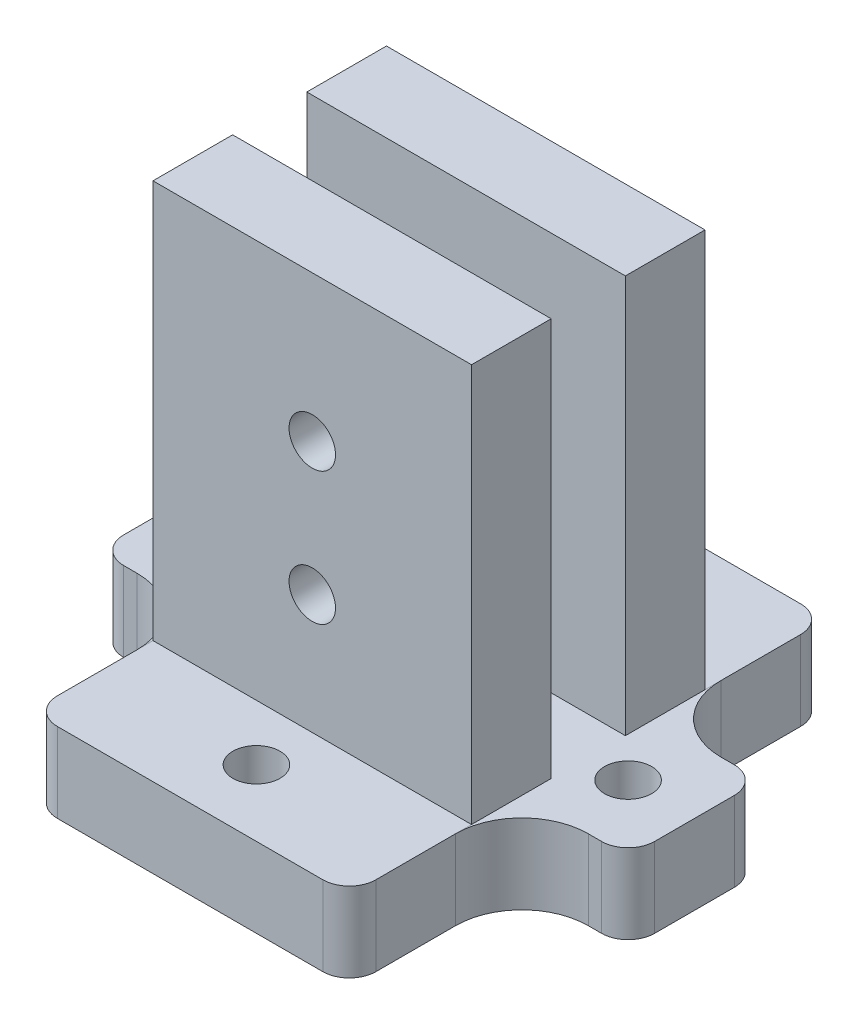
from build123d import *

# Parameters (mm, degrees)
SKETCH1_W           = 24
SKETCH1_H           = 24
BOSS_EXTRUDE1_DEPTH = 6
SKETCH2_W           = 24
SKETCH2_H           = 6
BOSS_EXTRUDE2_DEPTH = 30
SKETCH3_W           = 24
SKETCH3_H           = 6
BOSS_EXTRUDE3_DEPTH = 6
SKETCH4_W           = 24
SKETCH4_H           = 6
BOSS_EXTRUDE4_DEPTH = 6
SKETCH5_W           = 10
SKETCH5_H           = 6
BOSS_EXTRUDE5_DEPTH = 8
FILLET1_R           = 5
FILLET2_R           = 2
FILLET3_R           = 2
SKETCH6_W           = 10
SKETCH6_H           = 6
BOSS_EXTRUDE6_DEPTH = 8
FILLET4_R           = 5
FILLET5_R           = 2
SKETCH7_R           = 1.775
CUT_EXTRUDE1_DEPTH  = 42.568724431
CUT_EXTRUDE2_REACH  = 51.934
SKETCH8_R           = 1.75


with BuildPart() as part:
    # Sketch1 → Boss-Extrude1 (new body)
    with BuildSketch(Plane(origin=(0, 0, 0), x_dir=(1, 0, 0), z_dir=(0, 1, 0))):
        with Locations((1.896724894, -0.667948192)):
            Rectangle(SKETCH1_W, SKETCH1_H)
    extrude(amount=BOSS_EXTRUDE1_DEPTH)

    # Sketch2 → Boss-Extrude2 (add)
    with BuildSketch(Plane(origin=(0, 6, 0), x_dir=(1, 0, 0), z_dir=(0, 1, 0))):
        with Locations((1.896724894, -6.462948192)):
            Rectangle(SKETCH2_W, SKETCH2_H)
        with Locations((1.896724894, 5.127051808)):
            Rectangle(SKETCH2_W, SKETCH2_H)
    extrude(amount=BOSS_EXTRUDE2_DEPTH)

    # Sketch3 → Boss-Extrude3 (add)
    with BuildSketch(Plane.XY.offset(12.667948192)):
        with Locations((1.896724894, 3)):
            Rectangle(SKETCH3_W, SKETCH3_H)
    extrude(amount=BOSS_EXTRUDE3_DEPTH)

    # Sketch4 → Boss-Extrude4 (add)
    with BuildSketch(Plane(origin=(0, 0, -11.332051808), x_dir=(-1, 0, 0), z_dir=(0, 0, -1))):
        with Locations((-1.896724894, 3)):
            Rectangle(SKETCH4_W, SKETCH4_H)
    extrude(amount=BOSS_EXTRUDE4_DEPTH)

    # Sketch5 → Boss-Extrude5 (add)
    with BuildSketch(Plane(origin=(13.896724894, 0, 0), x_dir=(0, 0, -1), z_dir=(1, 0, 0))):
        with Locations((-0.667948192, 3)):
            Rectangle(SKETCH5_W, SKETCH5_H)
    extrude(amount=BOSS_EXTRUDE5_DEPTH)

    # Fillet1
    # the kernel refuses this fillet: 5 mm, written as the material it adds along each edge
    with BuildSketch(Plane(origin=(13.896724894, 0, -4.332051808), x_dir=(0, 0, -1), z_dir=(0, 1, 0)), Plane(origin=(13.896724894, 6, 5.667948192), x_dir=(0, 0, 1), z_dir=(0, -1, 0))) as fillet1_piece_1:
        with BuildLine():
            CenterArc((FILLET1_R, -FILLET1_R), FILLET1_R, 90, 90)
            Line((0, -FILLET1_R), (0, 0))
            Line((0, 0), (FILLET1_R, 0))
        make_face()
    extrude(amount=6)

    # Fillet2
    fillet2_edges = [part.edges().sort_by_distance(p)[0] for p in [
        (21.896724894, 3, -4.332051808),
        (21.896724894, 3, 5.667948192),
    ]]
    fillet(fillet2_edges, radius=FILLET2_R)

    # Fillet3
    fillet3_edges = [part.edges().sort_by_distance(p)[0] for p in [
        (-10.103275106, 3, 18.667948192),
        (13.896724894, 3, 18.667948192),
        (13.896724894, 3, -17.332051808),
        (-10.103275106, 3, -17.332051808),
    ]]
    fillet(fillet3_edges, radius=FILLET3_R)

    # Sketch6 → Boss-Extrude6 (add)
    with BuildSketch(Plane.ZY.offset(10.103275106)):
        with Locations((0.667948192, 3)):
            Rectangle(SKETCH6_W, SKETCH6_H)
    extrude(amount=BOSS_EXTRUDE6_DEPTH)

    # Fillet4
    # the kernel refuses this fillet: 5 mm, written as the material it adds along each edge
    with BuildSketch(Plane(origin=(-10.103275106, 6, -4.332051808), x_dir=(0, 0, -1), z_dir=(0, -1, 0)), Plane(origin=(-10.103275106, 0, 5.667948192), x_dir=(0, 0, 1), z_dir=(0, 1, 0))) as fillet4_piece_1:
        with BuildLine():
            CenterArc((FILLET4_R, -FILLET4_R), FILLET4_R, 90, 90)
            Line((0, -FILLET4_R), (0, 0))
            Line((0, 0), (FILLET4_R, 0))
        make_face()
    extrude(amount=6)

    # Fillet5
    fillet5_edges = [part.edges().sort_by_distance(p)[0] for p in [
        (-18.103275106, 3, -4.332051808),
        (-18.103275106, 3, 5.667948192),
    ]]
    fillet(fillet5_edges, radius=FILLET5_R)

    # Sketch7 → Cut-Extrude1 (cut, through all)
    with BuildSketch(Plane(origin=(0, 6, 0), x_dir=(1, 0, 0), z_dir=(0, 1, 0))):
        with Locations(Location((1.896724894, -13.667948192, 0), (0, 0, 270))):
            Circle(SKETCH7_R)
        with Locations(Location((-13.103275106, -0.667948192, 0), (0, 0, 270))):
            Circle(SKETCH7_R)
        with Locations(Location((1.896724894, 12.332051808, 0), (0, 0, 270))):
            Circle(SKETCH7_R)
        with Locations(Location((16.896724894, -0.667948192, 0), (0, 0, 270))):
            Circle(SKETCH7_R)
    extrude(amount=-CUT_EXTRUDE1_DEPTH, mode=Mode.SUBTRACT)

    # Cut-Extrude2: up to this face of the body (flat: up to its plane)
    cut_extrude2_end = Plane(part.part.faces().sort_by_distance((1.896724894, 21, -8.127051808))[0])
    # Sketch8 → Cut-Extrude2 (cut, up to the picked face)
    with BuildSketch(Plane.XY.offset(9.462948192), mode=Mode.PRIVATE) as cut_extrude2_sk1:
        with Locations((1.896724894, 15)):
            Circle(SKETCH8_R)
    cut_extrude2_tool1 = split(extrude(cut_extrude2_sk1.sketch, amount=-CUT_EXTRUDE2_REACH, mode=Mode.PRIVATE), bisect_by=cut_extrude2_end, keep=Keep.BOTH, mode=Mode.PRIVATE)
    # Sketch8 → Cut-Extrude2 (cut, up to the picked face)
    with BuildSketch(Plane.XY.offset(9.462948192), mode=Mode.PRIVATE) as cut_extrude2_sk2:
        with Locations((1.896724894, 25)):
            Circle(SKETCH8_R)
    cut_extrude2_tool2 = split(extrude(cut_extrude2_sk2.sketch, amount=-CUT_EXTRUDE2_REACH, mode=Mode.PRIVATE), bisect_by=cut_extrude2_end, keep=Keep.BOTH, mode=Mode.PRIVATE)
    add(cut_extrude2_tool1.solids().sort_by(Axis((1.896725, 15, 9.462948), (0, 0, -1)))[0], mode=Mode.SUBTRACT)
    add(cut_extrude2_tool2.solids().sort_by(Axis((1.896725, 25, 9.462948), (0, 0, -1)))[0], mode=Mode.SUBTRACT)


solid = part.part
